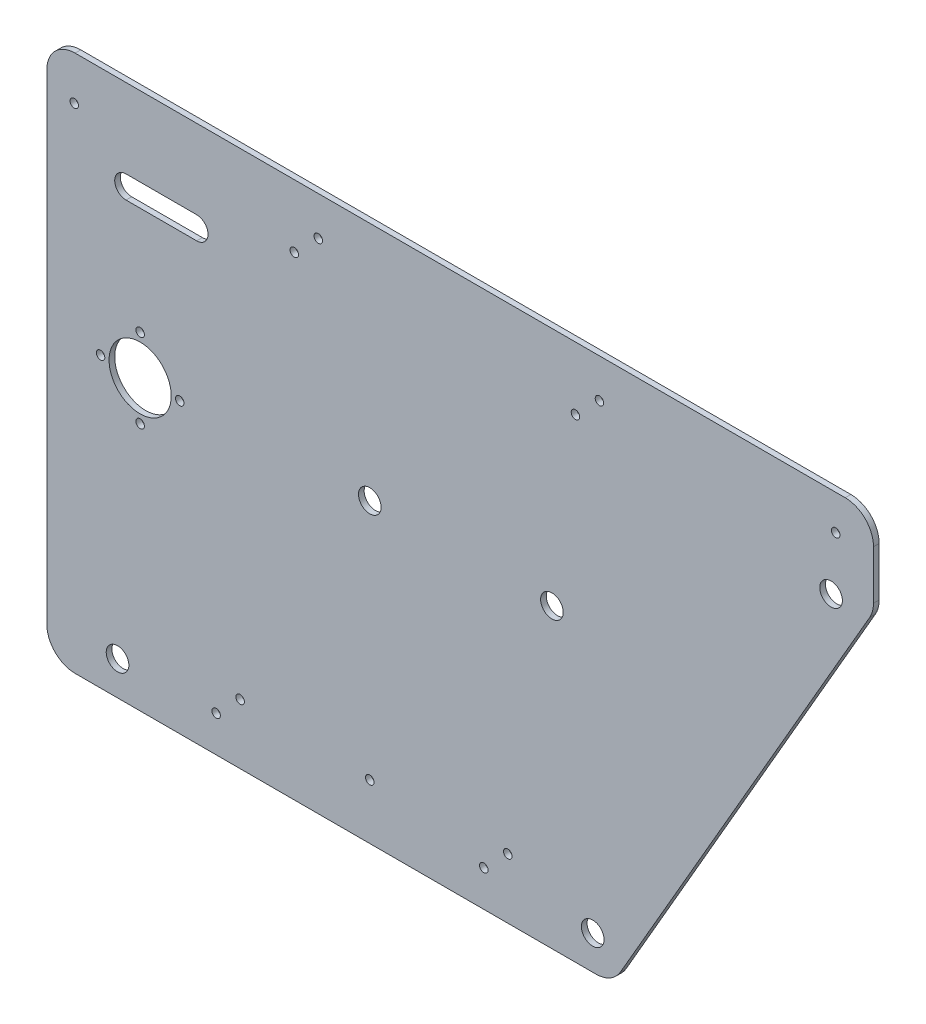
from build123d import *

# Parameters (mm, degrees)
BOSS_EXTRUDE1_DEPTH = 2
FILLET1_R           = 10
SKETCH2_R           = 4
SKETCH2_R_2         = 11
SKETCH2_R_3         = 1.5
CUT_EXTRUDE1_DEPTH  = 3


with BuildPart() as part:
    # Sketch1 → Boss-Extrude1 (new body)
    with BuildSketch(Plane.XY):
        Polygon((-100, 110), (-100, -80), (100, -80), (192.37604307, 80), (192.37604307, 110), align=None)
    extrude(amount=BOSS_EXTRUDE1_DEPTH)

    # Fillet1
    fillet1_edges = [part.edges().sort_by_distance(p)[0] for p in [
        (100, -80, 1),
        (-100, -80, 1),
        (192.37604307, 110, 1),
        (192.37604307, 80, 1),
        (-100, 110, 1),
    ]]
    fillet(fillet1_edges, radius=FILLET1_R)

    # Sketch2 → Cut-Extrude1 (cut)
    with BuildSketch(Plane.XY.offset(2)):
        with Locations((93.07179677, -68)):
            Circle(SKETCH2_R)
        with Locations((177.364936071, 78)):
            Circle(SKETCH2_R)
        with Locations((-67, 22)):
            Circle(SKETCH2_R_2)
        with Locations((-75, -68)):
            Circle(SKETCH2_R)
        with Locations((-53, 22)):
            Circle(SKETCH2_R_3)
        with Locations((-67, 36)):
            Circle(SKETCH2_R_3)
        with Locations((-81, 22)):
            Circle(SKETCH2_R_3)
        with Locations((-67, 8)):
            Circle(SKETCH2_R_3)
        with Locations((54.54952947, -67.242640687)):
            Circle(SKETCH2_R_3)
        with Locations((63.034810844, -58.757359313)):
            Circle(SKETCH2_R_3)
        with Locations((14.225855729, -60.5)):
            Circle(SKETCH2_R_3)
        with Locations((-40.127135228, -67.242640687)):
            Circle(SKETCH2_R_3)
        with Locations((-31.641853854, -58.757359313)):
            Circle(SKETCH2_R_3)
        with Locations((-90.295627115, 94.5)):
            Circle(SKETCH2_R_3)
        with Locations((-12.482801161, 87.757359313)):
            Circle(SKETCH2_R_3)
        with Locations((-3.997519787, 96.242640687)):
            Circle(SKETCH2_R_3)
        with Locations((86.965374539, 87.757359313)):
            Circle(SKETCH2_R_3)
        with Locations((95.450655913, 96.242640687)):
            Circle(SKETCH2_R_3)
        with Locations((78.638243285, 25)):
            Circle(SKETCH2_R)
        with Locations((14.225855729, 25)):
            Circle(SKETCH2_R)
        with Locations((178.99327299, 97.609508858)):
            Circle(SKETCH2_R_3)
        with BuildLine():
            Line((-72, 82), (-47, 82))
            ThreePointArc((-47, 82), (-43, 78), (-47, 74))
            Line((-47, 74), (-72, 74))
            ThreePointArc((-72, 74), (-76, 78), (-72, 82))
        make_face()
    extrude(amount=-CUT_EXTRUDE1_DEPTH, mode=Mode.SUBTRACT)


solid = part.part
